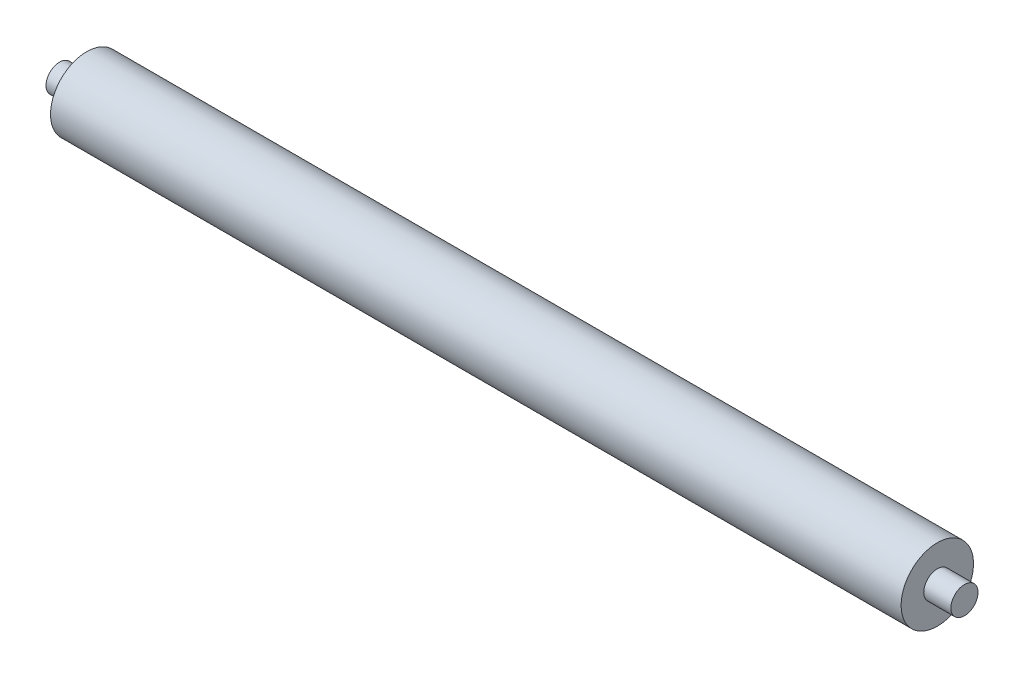
from build123d import *


with BuildPart() as part:
    # Esquisse1 → Révolution1 (revolve)
    with BuildSketch(Plane.XY):
        Polygon((0, 0), (100, 0), (100, 1.5), (97, 1.5), (97, 4), (3, 4), (3, 1.5), (0, 1.5), align=None)
    revolve(axis=Axis((0, 0, 0), (1, 0, 0)))


solid = part.part
